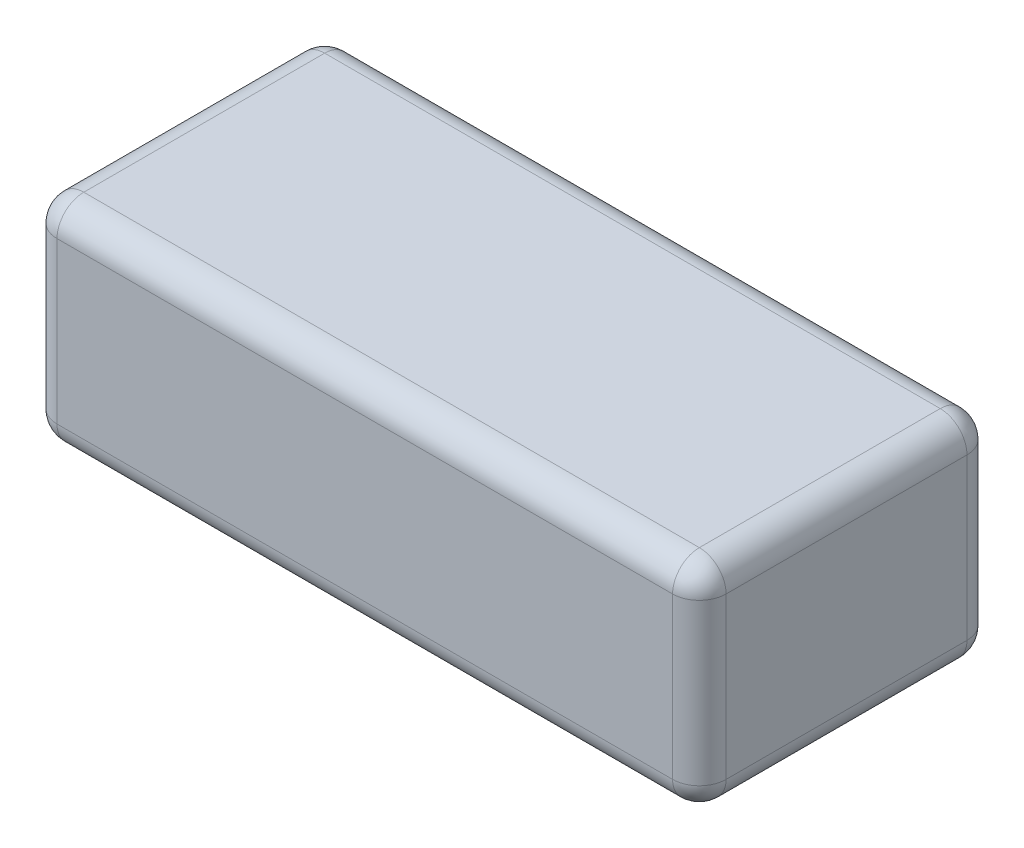
from build123d import *

# Parameters (mm, degrees)
SKETCH_1_W      = 50
SKETCH_1_H      = 16
EXTRUDE_1_DEPTH = 11
FILLET_1_R      = 2


with BuildPart() as part:
    # 草图1 → 凸台-拉伸1 (new, symmetric)
    with BuildSketch(Plane.XY):
        Rectangle(SKETCH_1_W, SKETCH_1_H)
    extrude(amount=EXTRUDE_1_DEPTH, both=True)

    # 圆角1
    fillet_1_edges = [part.edges().sort_by_distance(p)[0] for p in [
        (25, 0, -11),
        (0, 8, -11),
        (-25, 0, -11),
        (0, -8, -11),
        (25, 0, 11),
        (0, 8, 11),
        (-25, 0, 11),
        (0, -8, 11),
        (25, -8, 0),
        (-25, -8, 0),
        (-25, 8, 0),
        (25, 8, 0),
    ]]
    fillet(fillet_1_edges, radius=FILLET_1_R)


solid = part.part
